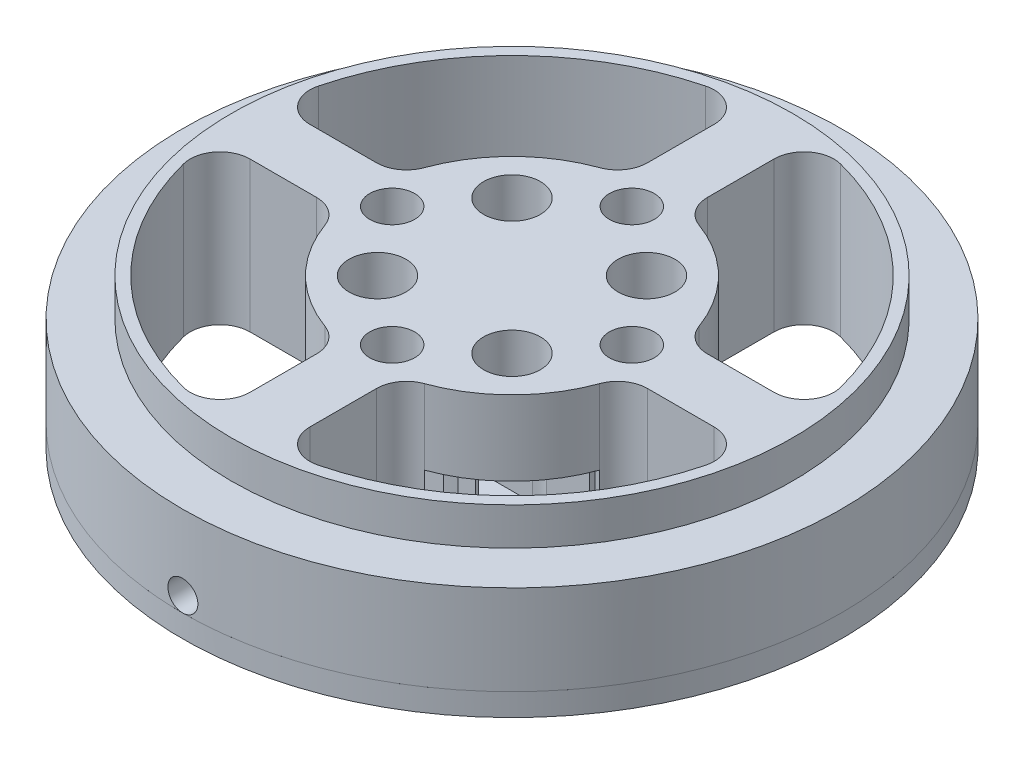
from build123d import *
from build123d.topology import SkipClean

# Parameters (mm, degrees)
SKETCH1_W                = 4
SKETCH1_H                = 4
BOSS_EXTRUDE1_DEPTH      = 10
FILLET1_R                = 2
BOSS_EXTRUDE2_DEPTH      = 1.5
FILLET2_R                = 2
CIRPATTERN1_COUNT        = 26
FILLET2_OF_CIRPATTERN1_R = 2
CUT_EXTRUDE1_START       = -2.5
CUT_EXTRUDE1_DEPTH       = 2.5
FILLET3_R                = 2
CIRPATTERN2_COUNT        = 26
FILLET3_OF_CIRPATTERN2_R = 2
SKETCH4_R                = 1.5
CUT_EXTRUDE2_DEPTH       = 2.75
SKETCH8_R                = 9.75
CUT_EXTRUDE6_DEPTH       = 5
CUT_EXTRUDE7_DEPTH       = 3
CUT_EXTRUDE8_REACH       = 35.193
SKETCH10_R               = 1.9
CUT_EXTRUDE9_REACH       = 53.795
CUT_EXTRUDE9_END_RADIUS  = 9.75
SKETCH11_R               = 1
BOSS_EXTRUDE3_START      = 5
BOSS_EXTRUDE3_DEPTH      = 5
SKETCH13_R               = 8.25
BOSS_EXTRUDE4_DEPTH      = 0.2
CUT_EXTRUDE10_START      = -2.5
SKETCH14_R               = 20
SKETCH14_R_2             = 18.75
CUT_EXTRUDE10_DEPTH      = 2.5
CUT_EXTRUDE11_START      = -1.5
SKETCH15_R               = 23.24877744
SKETCH15_R_2             = 22.000061981
CUT_EXTRUDE11_DEPTH      = 1.5


with BuildPart() as part:
    # Sketch1 → Boss-Extrude1 (new body)
    with BuildSketch(Plane(origin=(0, 0, 0), x_dir=(1, 0, 0), z_dir=(0, 1, 0))):
        with BuildLine():
            ThreePointArc((2, -21.9089023), (15.556349186, -15.556349186), (21.9089023, -2))
            Line((21.9089023, -2), (17.88854382, -2))
            ThreePointArc((17.88854382, -2), (12.727922061, -12.727922061), (2, -17.88854382))
            Line((2, -17.88854382), (2, -21.9089023))
        make_face()
        with BuildLine():
            ThreePointArc((2, 21.9089023), (0, 22), (-2, 21.9089023))
            Line((-2, 21.9089023), (-2, 17.88854382))
            ThreePointArc((-2, 17.88854382), (0, 18), (2, 17.88854382))
            Line((2, 17.88854382), (2, 21.9089023))
        make_face()
        with BuildLine():
            Line((-2, -17.88854382), (-2, -21.9089023))
            ThreePointArc((-2, -21.9089023), (0, -22), (2, -21.9089023))
            Line((2, -21.9089023), (2, -17.88854382))
            ThreePointArc((2, -17.88854382), (0, -18), (-2, -17.88854382))
        make_face()
        with BuildLine():
            Line((-17.88854382, -2), (-21.9089023, -2))
            ThreePointArc((-21.9089023, -2), (-15.556349186, -15.556349186), (-2, -21.9089023))
            Line((-2, -21.9089023), (-2, -17.88854382))
            ThreePointArc((-2, -17.88854382), (-12.727922061, -12.727922061), (-17.88854382, -2))
        make_face()
        with BuildLine():
            Line((-17.88854382, 2), (-21.9089023, 2))
            ThreePointArc((-21.9089023, 2), (-22, 0), (-21.9089023, -2))
            Line((-21.9089023, -2), (-17.88854382, -2))
            ThreePointArc((-17.88854382, -2), (-18, 0), (-17.88854382, 2))
        make_face()
        with BuildLine():
            ThreePointArc((22, 0), (21.977213775, 1.001036811), (21.9089023, 2))
            Line((21.9089023, 2), (17.88854382, 2))
            ThreePointArc((17.88854382, 2), (17.972114355, 1.001551606), (18, 0))
            ThreePointArc((18, 0), (17.972114355, -1.001551606), (17.88854382, -2))
            Line((17.88854382, -2), (21.9089023, -2))
            ThreePointArc((21.9089023, -2), (21.977213775, -1.001036811), (22, 0))
        make_face()
        with BuildLine():
            Line((-2, 17.88854382), (-2, 21.9089023))
            ThreePointArc((-2, 21.9089023), (-15.556349186, 15.556349186), (-21.9089023, 2))
            Line((-21.9089023, 2), (-17.88854382, 2))
            ThreePointArc((-17.88854382, 2), (-12.727922061, 12.727922061), (-2, 17.88854382))
        make_face()
        with BuildLine():
            ThreePointArc((21.9089023, 2), (15.556349186, 15.556349186), (2, 21.9089023))
            Line((2, 21.9089023), (2, 17.88854382))
            ThreePointArc((2, 17.88854382), (12.727922061, 12.727922061), (17.88854382, 2))
            Line((17.88854382, 2), (21.9089023, 2))
        make_face()
        with BuildLine():
            ThreePointArc((2, 17.88854382), (0, 18), (-2, 17.88854382))
            Line((-2, 17.88854382), (-2, 9.542667342))
            ThreePointArc((-2, 9.542667342), (0, 9.75), (2, 9.542667342))
            Line((2, 9.542667342), (2, 17.88854382))
        make_face()
        with BuildLine():
            Line((-2, -9.542667342), (-2, -17.88854382))
            ThreePointArc((-2, -17.88854382), (0, -18), (2, -17.88854382))
            Line((2, -17.88854382), (2, -9.542667342))
            ThreePointArc((2, -9.542667342), (0, -9.75), (-2, -9.542667342))
        make_face()
        with BuildLine():
            Line((9.542667342, 2), (2, 2))
            Line((2, 2), (2, -2))
            Line((2, -2), (9.542667342, -2))
            ThreePointArc((9.542667342, -2), (9.69802832, -1.005358994), (9.75, 0))
            ThreePointArc((9.75, 0), (9.69802832, 1.005358994), (9.542667342, 2))
        make_face()
        with BuildLine():
            Line((2, -2), (-2, -2))
            Line((-2, -2), (-2, -9.542667342))
            ThreePointArc((-2, -9.542667342), (0, -9.75), (2, -9.542667342))
            Line((2, -9.542667342), (2, -2))
        make_face()
        with BuildLine():
            Line((-9.542667342, 2), (-17.88854382, 2))
            ThreePointArc((-17.88854382, 2), (-18, 0), (-17.88854382, -2))
            Line((-17.88854382, -2), (-9.542667342, -2))
            ThreePointArc((-9.542667342, -2), (-9.75, 0), (-9.542667342, 2))
        make_face()
        with BuildLine():
            ThreePointArc((18, 0), (17.972114355, 1.001551606), (17.88854382, 2))
            Line((17.88854382, 2), (9.542667342, 2))
            ThreePointArc((9.542667342, 2), (9.69802832, 1.005358994), (9.75, 0))
            ThreePointArc((9.75, 0), (9.69802832, -1.005358994), (9.542667342, -2))
            Line((9.542667342, -2), (17.88854382, -2))
            ThreePointArc((17.88854382, -2), (17.972114355, -1.001551606), (18, 0))
        make_face()
        with BuildLine():
            Line((9.542667342, -2), (2, -2))
            Line((2, -2), (2, -9.542667342))
            ThreePointArc((2, -9.542667342), (6.894291117, -6.894291117), (9.542667342, -2))
        make_face()
        with BuildLine():
            Line((-2, -9.542667342), (-2, -2))
            Line((-2, -2), (-9.542667342, -2))
            ThreePointArc((-9.542667342, -2), (-6.894291117, -6.894291117), (-2, -9.542667342))
        make_face()
        with BuildLine():
            Line((-2, -2), (-2, 2))
            Line((-2, 2), (-9.542667342, 2))
            ThreePointArc((-9.542667342, 2), (-9.75, 0), (-9.542667342, -2))
            Line((-9.542667342, -2), (-2, -2))
        make_face()
        with BuildLine():
            ThreePointArc((2, 9.542667342), (0, 9.75), (-2, 9.542667342))
            Line((-2, 9.542667342), (-2, 2))
            Line((-2, 2), (2, 2))
            Line((2, 2), (2, 9.542667342))
        make_face()
        Rectangle(SKETCH1_W, SKETCH1_H)
        with BuildLine():
            ThreePointArc((9.542667342, 2), (6.894291117, 6.894291117), (2, 9.542667342))
            Line((2, 9.542667342), (2, 2))
            Line((2, 2), (9.542667342, 2))
        make_face()
        with BuildLine():
            Line((-2, 2), (-2, 9.542667342))
            ThreePointArc((-2, 9.542667342), (-6.894291117, 6.894291117), (-9.542667342, 2))
            Line((-9.542667342, 2), (-2, 2))
        make_face()
    extrude(amount=BOSS_EXTRUDE1_DEPTH)

    # Fillet1
    fillet1_edges = [part.edges().sort_by_distance(p)[0] for p in [
        (17.88854382, 5, 2),
        (9.542667342, 5, 2),
        (2, 5, 9.542667342),
        (2, 5, 17.88854382),
        (2, 5, -9.542667342),
        (9.542667342, 5, -2),
        (17.88854382, 5, -2),
        (2, 5, -17.88854382),
        (-2, 5, 17.88854382),
        (-2, 5, 9.542667342),
        (-9.542667342, 5, 2),
        (-17.88854382, 5, 2),
        (-17.88854382, 5, -2),
        (-9.542667342, 5, -2),
        (-2, 5, -9.542667342),
        (-2, 5, -17.88854382),
    ]]
    fillet(fillet1_edges, radius=FILLET1_R)

    # Sketch2 → Boss-Extrude2 (add)
    with BuildSketch(Plane.XZ):
        with BuildLine():
            Line((1, 23.227260976), (-1, 23.227260976))
            Line((-1, 23.227260976), (-1, 21.977260976))
            ThreePointArc((-1, 21.977260976), (0, 22), (1, 21.977260976))
            Line((1, 21.977260976), (1, 23.227260976))
        make_face()
    boss_extrude2 = extrude(amount=-BOSS_EXTRUDE2_DEPTH)

    # Fillet2
    # the kernel refuses this fillet: 2 mm, written as the material it adds along each edge
    with BuildSketch(Plane(origin=(-1, 0, 21.977260976), x_dir=(-0.9965164866079756, 0, -0.0833959946190231), z_dir=(0, 1, 0))) as fillet2_piece_1:
        with BuildLine():
            CenterArc((1.748625289, 1.998554444), FILLET2_R, 202.11423331, 65.70722334)
            Line((-0.104244993, 1.245645608), (-0.141302399, 1.230587432))
            ThreePointArc((-0.141302399, 1.230587432), (-0.091983156, 0.619486964), (-0.039860659, -0.00333584))
            Line((-0.039860659, -0.00333584), (0.001520544, -0.039971089))
            ThreePointArc((0.001520544, -0.039971089), (0.836299051, -0.024098888), (1.671077559, -0.039971089))
            Line((1.671077559, -0.039971089), (1.672598103, 0))
        make_face()
    extrude(amount=1.5)
    with BuildSketch(Plane(origin=(1, 0, 21.977260976), x_dir=(0.9965164866079756, 0, -0.0833959946190233), z_dir=(0, 1, 0))) as fillet2_piece_2:
        with BuildLine():
            CenterArc((1.748625289, -1.998554444), FILLET2_R, 92.17854335, 65.70722334)
            Line((-0.104244993, -1.245645608), (-0.141302399, -1.230587432))
            ThreePointArc((-0.141302399, -1.230587432), (-0.091983156, -0.619486964), (-0.039860659, 0.00333584))
            Line((-0.039860659, 0.00333584), (0.001520544, 0.039971089))
            ThreePointArc((0.001520544, 0.039971089), (0.836299051, 0.024098888), (1.671077559, 0.039971089))
            Line((1.671077559, 0.039971089), (1.672598103, 0))
        make_face()
    extrude(amount=1.5)

    # CirPattern1: Boss-Extrude2 ×26 about axis
    cirpattern1_axis = Axis((0, 0, 0), (0, 1, 0))
    for i in range(1, CIRPATTERN1_COUNT):
        add(boss_extrude2.rotate(cirpattern1_axis, i * 360 / CIRPATTERN1_COUNT))

    # Fillet2 of CirPattern1
    # the kernel refuses this fillet: 2 mm, written as the material it adds along each edge
    with BuildSketch(Plane(origin=(4.288560992, 0, 21.577957378), x_dir=(-0.9875174964533451, 0, 0.1575093463846435), z_dir=(0, 1, 0)), Plane(origin=(9.327886408, 0, 19.92462133), x_dir=(-0.9211275788848948, 0, 0.389260816699616), z_dir=(0, 1, 0)), Plane(origin=(13.825108971, 0, 17.113338714), x_dir=(-0.8012050745941738, 0, 0.5983898632535017), z_dir=(0, 1, 0)), Plane(origin=(17.518866453, 0, 13.307491056), x_dir=(-0.634719443629989, 0, 0.7727426660137495), z_dir=(0, 1, 0)), Plane(origin=(20.194491095, 0, 8.728260389), x_dir=(-0.4313462257133342, 0, 0.902186473830583), z_dir=(0, 1, 0)), Plane(origin=(21.696485319, 0, 3.641774953), x_dir=(-0.20290473303795734, 0, 0.979198483102785), z_dir=(0, 1, 0)), Plane(origin=(21.937558679, 0, -1.656357205), x_dir=(0.03732884519289158, 0, 0.9993030357787197), z_dir=(0, 1, 0)), Plane(origin=(20.903700869, 0, -6.858227903), x_dir=(0.2753930066259576, 0, 0.9613317283339373), z_dir=(0, 1, 0)), Plane(origin=(18.654995946, 0, -11.661523324), x_dir=(0.4974523275267755, 0, 0.8674913151370414), z_dir=(0, 1, 0)), Plane(origin=(15.322130467, 0, -15.787093398), x_dir=(0.6906015273173737, 0, 0.7232354599070147), z_dir=(0, 1, 0)), Plane(origin=(11.098798459, 0, -18.995174986), x_dir=(0.8436154765747038, 0, 0.5369477886011221), z_dir=(0, 1, 0)), Plane(origin=(6.230444627, 0, -21.09932605), x_dir=(0.9476015607510001, 0, 0.31945466354753466), z_dir=(0, 1, 0)), Plane(origin=(1, 0, -21.977260976), x_dir=(0.9965164866079763, 0, 0.08339599461901703), z_dir=(0, 1, 0)), Plane(origin=(-4.288560992, 0, -21.577957378), x_dir=(0.9875174964533444, 0, -0.15750934638464753), z_dir=(0, 1, 0)), Plane(origin=(-9.327886408, 0, -19.92462133), x_dir=(0.9211275788848938, 0, -0.38926081669961826), z_dir=(0, 1, 0)), Plane(origin=(-13.825108971, 0, -17.113338714), x_dir=(0.8012050745941742, 0, -0.5983898632535011), z_dir=(0, 1, 0)), Plane(origin=(-17.518866453, 0, -13.307491056), x_dir=(0.6347194436299898, 0, -0.772742666013749), z_dir=(0, 1, 0)), Plane(origin=(-20.194491095, 0, -8.728260389), x_dir=(0.431346225713339, 0, -0.9021864738305808), z_dir=(0, 1, 0)), Plane(origin=(-21.696485319, 0, -3.641774953), x_dir=(0.20290473303796103, 0, -0.9791984831027842), z_dir=(0, 1, 0)), Plane(origin=(-21.937558679, 0, 1.656357205), x_dir=(-0.03732884519288293, 0, -0.99930303577872), z_dir=(0, 1, 0)), Plane(origin=(-20.903700869, 0, 6.858227903), x_dir=(-0.2753930066259506, 0, -0.9613317283339394), z_dir=(0, 1, 0)), Plane(origin=(-18.654995946, 0, 11.661523324), x_dir=(-0.49745232752677004, 0, -0.8674913151370446), z_dir=(0, 1, 0)), Plane(origin=(-15.322130467, 0, 15.787093398), x_dir=(-0.6906015273173698, 0, -0.7232354599070181), z_dir=(0, 1, 0)), Plane(origin=(-11.098798459, 0, 18.995174986), x_dir=(-0.8436154765746992, 0, -0.5369477886011296), z_dir=(0, 1, 0)), Plane(origin=(-6.230444627, 0, 21.09932605), x_dir=(-0.947601560750999, 0, -0.3194546635475381), z_dir=(0, 1, 0))) as fillet2_of_cirpattern1_piece_1:
        with BuildLine():
            CenterArc((1.748625289, 1.998554444), FILLET2_OF_CIRPATTERN1_R, 202.11423331, 65.70722334)
            Line((-0.104244993, 1.245645608), (-0.141302399, 1.230587432))
            ThreePointArc((-0.141302399, 1.230587432), (-0.091983156, 0.619486964), (-0.039860659, -0.00333584))
            Line((-0.039860659, -0.00333584), (0.001520544, -0.039971089))
            ThreePointArc((0.001520544, -0.039971089), (0.836299051, -0.024098888), (1.671077559, -0.039971089))
            Line((1.671077559, -0.039971089), (1.672598103, 0))
        make_face()
    extrude(amount=1.5)
    with BuildSketch(Plane(origin=(6.230444627, 0, 21.09932605), x_dir=(0.9476015607509982, 0, -0.3194546635475404), z_dir=(0, 1, 0)), Plane(origin=(11.098798459, 0, 18.995174986), x_dir=(0.8436154765747026, 0, -0.5369477886011241), z_dir=(0, 1, 0)), Plane(origin=(15.322130467, 0, 15.787093398), x_dir=(0.6906015273173723, 0, -0.7232354599070157), z_dir=(0, 1, 0)), Plane(origin=(18.654995946, 0, 11.661523324), x_dir=(0.4974523275267737, 0, -0.8674913151370424), z_dir=(0, 1, 0)), Plane(origin=(20.903700869, 0, 6.858227903), x_dir=(0.2753930066259588, 0, -0.9613317283339371), z_dir=(0, 1, 0)), Plane(origin=(21.937558679, 0, 1.656357205), x_dir=(0.037328845192891716, 0, -0.9993030357787197), z_dir=(0, 1, 0)), Plane(origin=(21.696485319, 0, -3.641774953), x_dir=(-0.20290473303795403, 0, -0.9791984831027857), z_dir=(0, 1, 0)), Plane(origin=(20.194491095, 0, -8.728260389), x_dir=(-0.43134622571333414, 0, -0.902186473830583), z_dir=(0, 1, 0)), Plane(origin=(17.518866453, 0, -13.307491056), x_dir=(-0.6347194436299866, 0, -0.7727426660137516), z_dir=(0, 1, 0)), Plane(origin=(13.825108971, 0, -17.113338714), x_dir=(-0.8012050745941711, 0, -0.5983898632535053), z_dir=(0, 1, 0)), Plane(origin=(9.327886408, 0, -19.92462133), x_dir=(-0.9211275788848943, 0, -0.38926081669961704), z_dir=(0, 1, 0)), Plane(origin=(4.288560992, 0, -21.577957378), x_dir=(-0.9875174964533442, 0, -0.15750934638464933), z_dir=(0, 1, 0)), Plane(origin=(-1, 0, -21.977260976), x_dir=(-0.996516486607976, 0, 0.08339599461901914), z_dir=(0, 1, 0)), Plane(origin=(-6.230444627, 0, -21.09932605), x_dir=(-0.9476015607509994, 0, 0.3194546635475369), z_dir=(0, 1, 0)), Plane(origin=(-11.098798459, 0, -18.995174986), x_dir=(-0.8436154765747029, 0, 0.5369477886011236), z_dir=(0, 1, 0)), Plane(origin=(-15.322130467, 0, -15.787093398), x_dir=(-0.6906015273173713, 0, 0.7232354599070168), z_dir=(0, 1, 0)), Plane(origin=(-18.654995946, 0, -11.661523324), x_dir=(-0.4974523275267707, 0, 0.8674913151370441), z_dir=(0, 1, 0)), Plane(origin=(-20.903700869, 0, -6.858227903), x_dir=(-0.2753930066259519, 0, 0.9613317283339391), z_dir=(0, 1, 0)), Plane(origin=(-21.937558679, 0, -1.656357205), x_dir=(-0.037328845192880995, 0, 0.9993030357787202), z_dir=(0, 1, 0)), Plane(origin=(-21.696485319, 0, 3.641774953), x_dir=(0.2029047330379618, 0, 0.9791984831027841), z_dir=(0, 1, 0)), Plane(origin=(-20.194491095, 0, 8.728260389), x_dir=(0.43134622571334064, 0, 0.9021864738305799), z_dir=(0, 1, 0)), Plane(origin=(-17.518866453, 0, 13.307491056), x_dir=(0.6347194436299933, 0, 0.772742666013746), z_dir=(0, 1, 0)), Plane(origin=(-13.825108971, 0, 17.113338714), x_dir=(0.8012050745941748, 0, 0.5983898632535004), z_dir=(0, 1, 0)), Plane(origin=(-9.327886408, 0, 19.92462133), x_dir=(0.9211275788848976, 0, 0.389260816699609), z_dir=(0, 1, 0)), Plane(origin=(-4.288560992, 0, 21.577957378), x_dir=(0.9875174964533451, 0, 0.15750934638464312), z_dir=(0, 1, 0))) as fillet2_of_cirpattern1_piece_2:
        with BuildLine():
            CenterArc((1.748625289, -1.998554444), FILLET2_OF_CIRPATTERN1_R, 92.17854335, 65.70722334)
            Line((-0.104244993, -1.245645608), (-0.141302399, -1.230587432))
            ThreePointArc((-0.141302399, -1.230587432), (-0.091983156, -0.619486964), (-0.039860659, 0.00333584))
            Line((-0.039860659, 0.00333584), (0.001520544, 0.039971089))
            ThreePointArc((0.001520544, 0.039971089), (0.836299051, 0.024098888), (1.671077559, 0.039971089))
            Line((1.671077559, 0.039971089), (1.672598103, 0))
        make_face()
    extrude(amount=1.5)

    # Sketch3 → Cut-Extrude1 (cut)
    with BuildSketch(Plane(origin=(0, 10, 0), x_dir=(1, 0, 0), z_dir=(0, 1, 0)).offset(CUT_EXTRUDE1_START)):
        with BuildLine():
            ThreePointArc((0, 20), (0.236315861, 19.998603822), (0.472598728, 19.994415481))
            Line((0.472598728, 19.994415481), (0.974339349, 18.724667229))
            ThreePointArc((0.974339349, 18.724667229), (2.247307757, 18.614835692), (3.509840592, 18.418564521))
            Line((3.509840592, 18.418564521), (4.29934642, 19.532424846))
            ThreePointArc((4.29934642, 19.532424846), (4.543184859, 19.477152547), (4.786313286, 19.418836349))
            Line((4.786313286, 19.418836349), (5.264944614, 21.360719983))
            ThreePointArc((5.264944614, 21.360719983), (2.651806966, 21.83959523), (0, 22))
            Line((0, 22), (0, 20))
        make_face()
    cut_extrude1 = extrude(amount=CUT_EXTRUDE1_DEPTH, mode=Mode.SUBTRACT)

    # Fillet3
    fillet3_edges = [part.edges().sort_by_distance(p)[0] for p in [
        (3.509840592, 8.75, -18.418564521),
        (0.974339349, 8.75, -18.724667229),
    ]]
    fillet(fillet3_edges, radius=FILLET3_R)

    # CirPattern2: Cut-Extrude1 ×26 about axis
    cirpattern2_axis = Axis((0, 0, 0), (0, 1, 0))
    for i in range(1, CIRPATTERN2_COUNT):
        add(cut_extrude1.rotate(cirpattern2_axis, i * 360 / CIRPATTERN2_COUNT), mode=Mode.SUBTRACT)

    # Fillet3 of CirPattern2
    fillet3_of_cirpattern2_edges = [part.edges().sort_by_distance(p)[0] for p in [
        (-1, 8.75, -18.723314343),
        (-3.535079358, 8.75, -18.413737098),
        (-5.451724227, 8.75, -17.939933192),
        (-7.839052103, 8.75, -17.032667499),
        (-9.586614058, 8.75, -16.113948333),
        (-11.687447633, 8.75, -14.661721176),
        (-13.164364727, 8.75, -13.351479369),
        (-14.856611188, 8.75, -11.438688911),
        (-15.977050367, 8.75, -9.813070955),
        (-17.162362503, 8.75, -7.550881625),
        (-17.861207915, 8.75, -5.704362525),
        (-18.470699692, 8.75, -3.224244544),
        (-18.707336981, 8.75, -1.26413728),
        (-18.705586953, 8.75, 1.289773909),
        (-18.466263621, 8.75, 3.249555028),
        (-17.853373493, 8.75, 5.728835391),
        (-17.151998141, 8.75, 7.57439501),
        (-15.963586859, 8.75, 9.834957783),
        (-14.840920874, 8.75, 11.459038686),
        (-13.146054582, 8.75, 13.369508178),
        (-11.66734323, 8.75, 14.677724686),
        (-9.564521397, 8.75, 16.127071353),
        (-7.815702007, 8.75, 17.043394678),
        (-5.427132994, 8.75, 17.947387761),
        (-3.509840592, 8.75, 18.418564521),
        (-0.974339349, 8.75, 18.724667229),
        (1, 8.75, 18.723314343),
        (3.535079358, 8.75, 18.413737098),
        (5.451724227, 8.75, 17.939933192),
        (7.839052103, 8.75, 17.032667499),
        (9.586614058, 8.75, 16.113948333),
        (11.687447633, 8.75, 14.661721176),
        (13.164364727, 8.75, 13.351479369),
        (14.856611188, 8.75, 11.438688911),
        (15.977050367, 8.75, 9.813070955),
        (17.162362503, 8.75, 7.550881625),
        (17.861207915, 8.75, 5.704362525),
        (18.470699692, 8.75, 3.224244544),
        (18.707336981, 8.75, 1.26413728),
        (18.705586953, 8.75, -1.289773909),
        (18.466263621, 8.75, -3.249555028),
        (17.853373493, 8.75, -5.728835391),
        (17.151998141, 8.75, -7.57439501),
        (15.963586859, 8.75, -9.834957783),
        (14.840920874, 8.75, -11.459038686),
        (13.146054582, 8.75, -13.369508178),
        (11.66734323, 8.75, -14.677724686),
        (9.564521397, 8.75, -16.127071353),
        (7.815702007, 8.75, -17.043394678),
        (5.427132994, 8.75, -17.947387761),
    ]]
    fillet(fillet3_of_cirpattern2_edges, radius=FILLET3_OF_CIRPATTERN2_R)

    # Sketch4 → Cut-Extrude2 (cut)
    with BuildSketch(Plane(origin=(0, 10, 0), x_dir=(1, 0, 0), z_dir=(0, 1, 0))):
        with Locations(Location((0, 8, 0), (0, 0, 270))):
            Circle(SKETCH4_R)
        with Locations(Location((0, -8, 0), (0, 0, 90))):
            Circle(SKETCH4_R)
        with Locations(Location((-8, 0, 0), (0, 0, 270))):
            Circle(SKETCH4_R)
        with Locations(Location((8, 0, 0), (0, 0, 90))):
            Circle(SKETCH4_R)
    extrude(amount=-CUT_EXTRUDE2_DEPTH, mode=Mode.SUBTRACT)

    # Sketch8 → Cut-Extrude6 (cut)
    with BuildSketch(Plane.XZ):
        Circle(SKETCH8_R)
    extrude(amount=-CUT_EXTRUDE6_DEPTH, mode=Mode.SUBTRACT)

    # Sketch9 → Cut-Extrude7 (cut)
    with BuildSketch(Plane.XZ.offset(-5)):
        with BuildLine():
            ThreePointArc((-1.414213562, 1.75), (0, -2.25), (1.414213562, 1.75))
            Line((1.414213562, 1.75), (-1.414213562, 1.75))
        make_face()
    extrude(amount=-CUT_EXTRUDE7_DEPTH, mode=Mode.SUBTRACT)

    # Sketch10 → Cut-Extrude8 (cut, up to next)
    with BuildSketch(Plane.XZ.offset(-5), mode=Mode.PRIVATE) as cut_extrude8_sk1:
        with Locations(Location((4.490128061, 4.490128061, 0), (0, 0, 270))):
            Circle(SKETCH10_R)
    cut_extrude8_tool1 = extrude(cut_extrude8_sk1.sketch, amount=-CUT_EXTRUDE8_REACH, mode=Mode.PRIVATE) & part.part
    # Sketch10 → Cut-Extrude8 (cut, up to next)
    with BuildSketch(Plane.XZ.offset(-5), mode=Mode.PRIVATE) as cut_extrude8_sk2:
        with Locations(Location((-4.490128061, 4.490128061, 0), (0, 0, 270))):
            Circle(SKETCH10_R)
    cut_extrude8_tool2 = extrude(cut_extrude8_sk2.sketch, amount=-CUT_EXTRUDE8_REACH, mode=Mode.PRIVATE) & part.part
    # Sketch10 → Cut-Extrude8 (cut, up to next)
    with BuildSketch(Plane.XZ.offset(-5), mode=Mode.PRIVATE) as cut_extrude8_sk3:
        with Locations(Location((4.490128061, -4.490128061, 0), (0, 0, 270))):
            Circle(SKETCH10_R)
    cut_extrude8_tool3 = extrude(cut_extrude8_sk3.sketch, amount=-CUT_EXTRUDE8_REACH, mode=Mode.PRIVATE) & part.part
    # Sketch10 → Cut-Extrude8 (cut, up to next)
    with BuildSketch(Plane.XZ.offset(-5), mode=Mode.PRIVATE) as cut_extrude8_sk4:
        with Locations(Location((-4.490128061, -4.490128061, 0), (0, 0, 270))):
            Circle(SKETCH10_R)
    cut_extrude8_tool4 = extrude(cut_extrude8_sk4.sketch, amount=-CUT_EXTRUDE8_REACH, mode=Mode.PRIVATE) & part.part
    add(cut_extrude8_tool1.solids().sort_by_distance((4.490128, 5, 4.490128))[0], mode=Mode.SUBTRACT)
    add(cut_extrude8_tool2.solids().sort_by_distance((-4.490128, 5, 4.490128))[0], mode=Mode.SUBTRACT)
    add(cut_extrude8_tool3.solids().sort_by_distance((4.490128, 5, -4.490128))[0], mode=Mode.SUBTRACT)
    add(cut_extrude8_tool4.solids().sort_by_distance((-4.490128, 5, -4.490128))[0], mode=Mode.SUBTRACT)

    # Cut-Extrude9: up to this cylinder (the profile starts outside it)
    cut_extrude9_end = Plane(origin=(0, 2.499998, 0), z_dir=(0, -1, 0)) * Cylinder(CUT_EXTRUDE9_END_RADIUS, 128.09, mode=Mode.PRIVATE)
    # Sketch11 → Cut-Extrude9 (cut, up to the surface)
    with BuildSketch(Plane.XY.offset(22), mode=Mode.PRIVATE) as cut_extrude9_sk1:
        with Locations((0.003425156, 2.499997654)):
            Circle(SKETCH11_R)
    cut_extrude9_tool1 = extrude(cut_extrude9_sk1.sketch, amount=-CUT_EXTRUDE9_REACH, mode=Mode.PRIVATE) - cut_extrude9_end
    add(cut_extrude9_tool1.solids().sort_by_distance((0.003425, 2.499998, 22))[0], mode=Mode.SUBTRACT)

    # Sketch12 → Boss-Extrude3 (add)
    with SkipClean():  # the faces are left unmerged after this step: merging them gives an invalid solid
        with BuildSketch(Plane.XZ.offset(-5).offset(BOSS_EXTRUDE3_START)):
            with BuildLine():
                ThreePointArc((-3.088689042, 7.65), (-3.421133886, 7.507219388), (-3.746998799, 7.35))
                Line((-3.746998799, 7.35), (3.746998799, 7.35))
                ThreePointArc((3.746998799, 7.35), (3.421133886, 7.507219388), (3.088689042, 7.65))
                Line((3.088689042, 7.65), (-3.088689042, 7.65))
            make_face()
            with BuildLine():
                ThreePointArc((-2.708396031, 5.15), (-2.660299702, 5.001721823), (-2.624520335, 4.85))
                Line((-2.624520335, 4.85), (2.624520335, 4.85))
                ThreePointArc((2.624520335, 4.85), (2.660299702, 5.001721823), (2.708396031, 5.15))
                Line((2.708396031, 5.15), (-2.708396031, 5.15))
            make_face()
            with BuildLine():
                ThreePointArc((-7.812809994, 2.65), (-7.861947854, 2.500455146), (-7.908223568, 2.35))
                Line((-7.908223568, 2.35), (7.908223568, 2.35))
                ThreePointArc((7.908223568, 2.35), (7.861947854, 2.500455146), (7.812809994, 2.65))
                Line((7.812809994, 2.65), (4.963339135, 2.65))
                ThreePointArc((4.963339135, 2.65), (4.490128061, 2.590128061), (4.016916986, 2.65))
                Line((4.016916986, 2.65), (-4.016916986, 2.65))
                ThreePointArc((-4.016916986, 2.65), (-4.490128061, 2.590128061), (-4.963339135, 2.65))
                Line((-4.963339135, 2.65), (-7.812809994, 2.65))
            make_face()
            with BuildLine():
                ThreePointArc((-8.25, 0), (-8.249659056, -0.0750031), (-8.248636251, -0.15))
                Line((-8.248636251, -0.15), (-2.244994432, -0.15))
                ThreePointArc((-2.244994432, -0.15), (-2.25, 0), (-2.244994432, 0.15))
                Line((-2.244994432, 0.15), (-8.248636251, 0.15))
                ThreePointArc((-8.248636251, 0.15), (-8.249659056, 0.0750031), (-8.25, 0))
            make_face()
            with BuildLine():
                Line((2.244994432, -0.15), (8.248636251, -0.15))
                ThreePointArc((8.248636251, -0.15), (8.249659056, -0.0750031), (8.25, 0))
                ThreePointArc((8.25, 0), (8.249659056, 0.0750031), (8.248636251, 0.15))
                Line((8.248636251, 0.15), (2.244994432, 0.15))
                ThreePointArc((2.244994432, 0.15), (2.25, 0), (2.244994432, -0.15))
            make_face()
            with BuildLine():
                Line((7.908223568, -2.35), (-7.908223568, -2.35))
                ThreePointArc((-7.908223568, -2.35), (-7.861947854, -2.500455146), (-7.812809994, -2.65))
                Line((-7.812809994, -2.65), (-4.963339135, -2.65))
                ThreePointArc((-4.963339135, -2.65), (-4.490128061, -2.590128061), (-4.016916986, -2.65))
                Line((-4.016916986, -2.65), (4.016916986, -2.65))
                ThreePointArc((4.016916986, -2.65), (4.490128061, -2.590128061), (4.963339135, -2.65))
                Line((4.963339135, -2.65), (7.812809994, -2.65))
                ThreePointArc((7.812809994, -2.65), (7.861947854, -2.500455146), (7.908223568, -2.35))
            make_face()
            with BuildLine():
                Line((2.624520335, -4.85), (-2.624520335, -4.85))
                ThreePointArc((-2.624520335, -4.85), (-2.660299702, -5.001721823), (-2.708396031, -5.15))
                Line((-2.708396031, -5.15), (2.708396031, -5.15))
                ThreePointArc((2.708396031, -5.15), (2.660299702, -5.001721823), (2.624520335, -4.85))
            make_face()
            with BuildLine():
                Line((3.746998799, -7.35), (-3.746998799, -7.35))
                ThreePointArc((-3.746998799, -7.35), (-3.421133886, -7.507219388), (-3.088689042, -7.65))
                Line((-3.088689042, -7.65), (3.088689042, -7.65))
                ThreePointArc((3.088689042, -7.65), (3.421133886, -7.507219388), (3.746998799, -7.35))
            make_face()
        extrude(amount=-BOSS_EXTRUDE3_DEPTH)

    # Sketch13 → Boss-Extrude4 (add)
    with SkipClean():  # the faces are left unmerged after this step: merging them gives an invalid solid
        with BuildSketch(Plane.XZ):
            with Locations(Location((0, 0, 0), (0, 0, 90))):
                Circle(SKETCH13_R)
        extrude(amount=-BOSS_EXTRUDE4_DEPTH)

    # Sketch14 → Cut-Extrude10 (cut)
    with SkipClean():  # the faces are left unmerged after this step: merging them gives an invalid solid
        with BuildSketch(Plane(origin=(0, 10, 0), x_dir=(1, 0, 0), z_dir=(0, 1, 0)).offset(CUT_EXTRUDE10_START)):
            Circle(SKETCH14_R)
            with Locations(Location((0, 0, 0), (0, 0, 270))):
                Circle(SKETCH14_R_2, mode=Mode.SUBTRACT)
        extrude(amount=CUT_EXTRUDE10_DEPTH, mode=Mode.SUBTRACT)

    # Sketch15 → Cut-Extrude11 (cut)
    with SkipClean():  # the faces are left unmerged after this step: merging them gives an invalid solid
        with BuildSketch(Plane.XZ.offset(CUT_EXTRUDE11_START)):
            Circle(SKETCH15_R)
            with Locations(Location((0, 0, 0), (0, 0, 270))):
                Circle(SKETCH15_R_2, mode=Mode.SUBTRACT)
        extrude(amount=CUT_EXTRUDE11_DEPTH, mode=Mode.SUBTRACT)


solid = part.part
